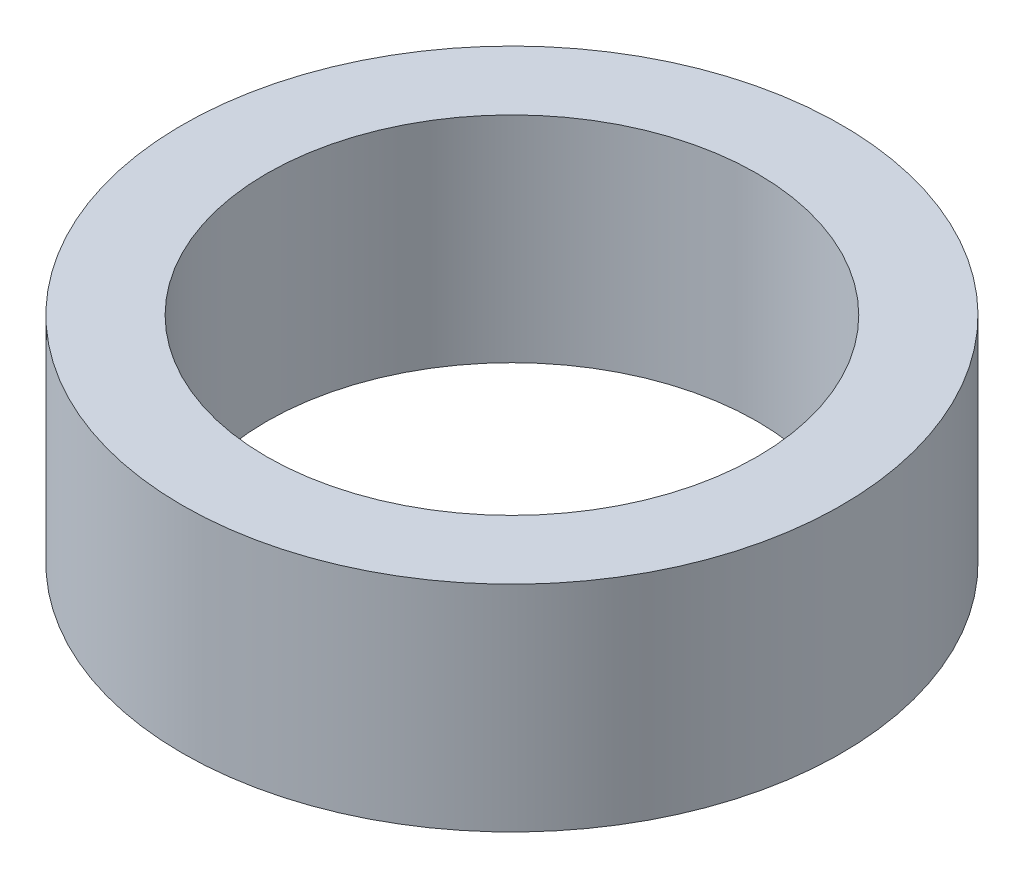
from build123d import *

# Parameters (mm, degrees)
SKETCH1_R           = 21.5
SKETCH1_R_2         = 16
BOSS_EXTRUDE1_DEPTH = 14


with BuildPart() as part:
    # Sketch1 → Boss-Extrude1 (new body)
    with BuildSketch(Plane(origin=(0, 0, 0), x_dir=(1, 0, 0), z_dir=(0, 1, 0))):
        Circle(SKETCH1_R)
        Circle(SKETCH1_R_2, mode=Mode.SUBTRACT)
    extrude(amount=BOSS_EXTRUDE1_DEPTH)


solid = part.part
